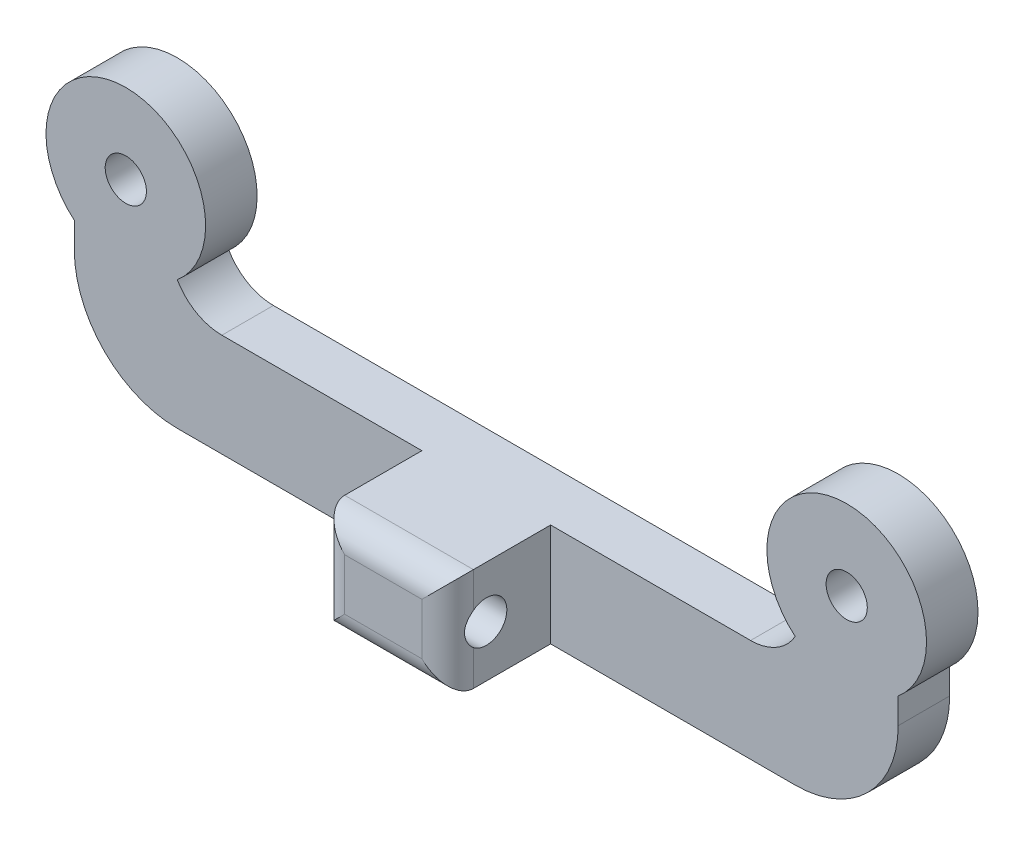
from build123d import *

# Parameters (mm, degrees)
CROQUIS1_R              = 1.6
SALIENTE_EXTRUIR1_DEPTH = 4
CROQUIS2_W              = 10
CROQUIS2_H              = 8
SALIENTE_EXTRUIR2_DEPTH = 8
CORTAR_EXTRUIR1_REACH   = 45.564
CROQUIS3_R              = 1.6
REDONDEO1_R             = 2
REDONDEO2_R             = 8
REDONDEO3_R             = 4


with BuildPart() as part:
    # Croquis1 → Saliente-Extruir1 (new body)
    with BuildSketch(Plane.XY):
        with BuildLine():
            Line((-4, -4.737087713), (-4, -14.737087713))
            Line((-4, -14.737087713), (60, -14.737087713))
            Line((60, -14.737087713), (60, -4.737087713))
            ThreePointArc((60, -4.737087713), (56, 6.2), (52, -4.737087713))
            Line((52, -4.737087713), (52, -6.737087713))
            Line((52, -6.737087713), (4, -6.737087713))
            Line((4, -6.737087713), (4, -4.737087713))
            ThreePointArc((4, -4.737087713), (0, 6.2), (-4, -4.737087713))
        make_face()
        Circle(CROQUIS1_R, mode=Mode.SUBTRACT)
        with Locations((56, 0)):
            Circle(CROQUIS1_R, mode=Mode.SUBTRACT)
    extrude(amount=SALIENTE_EXTRUIR1_DEPTH)

    # Croquis2 → Saliente-Extruir2 (add)
    with BuildSketch(Plane.XY.offset(4)):
        with Locations((28, -10.737087713)):
            Rectangle(CROQUIS2_W, CROQUIS2_H)
    extrude(amount=SALIENTE_EXTRUIR2_DEPTH)

    # Croquis3 → Cortar-Extruir1 (cut, up to next)
    with BuildSketch(Plane.ZY.offset(-23), mode=Mode.PRIVATE) as cortar_extruir1_sk1:
        with Locations((9, -10.737087713)):
            Circle(CROQUIS3_R)
    cortar_extruir1_tool1 = extrude(cortar_extruir1_sk1.sketch, amount=-CORTAR_EXTRUIR1_REACH, mode=Mode.PRIVATE) & part.part
    add(cortar_extruir1_tool1.solids().sort_by_distance((23, -10.737088, 9))[0], mode=Mode.SUBTRACT)

    # Redondeo1
    # the kernel refuses this fillet: 2 mm, written as the material it takes off along each edge
    with BuildSketch(Plane(origin=(33, -1.737087713, 12), x_dir=(-1, 0, 0), z_dir=(0, -1, 0))) as redondeo1_piece_1:
        with BuildLine():
            CenterArc((REDONDEO1_R, REDONDEO1_R), REDONDEO1_R, 180, 90)
            Line((0, REDONDEO1_R), (0, 0))
            Line((0, 0), (REDONDEO1_R, 0))
        make_face()
    extrude(amount=18, mode=Mode.SUBTRACT)
    with BuildSketch(Plane(origin=(23, -19.737087713, 12), x_dir=(0, 0, -1), z_dir=(0, 1, 0))) as redondeo1_piece_2:
        with BuildLine():
            CenterArc((REDONDEO1_R, -REDONDEO1_R), REDONDEO1_R, 90, 90)
            Line((0, -REDONDEO1_R), (0, 0))
            Line((0, 0), (REDONDEO1_R, 0))
        make_face()
    extrude(amount=18, mode=Mode.SUBTRACT)
    with BuildSketch(Plane(origin=(18, -6.737087713, 12), x_dir=(0, -1, 0), z_dir=(1, 0, 0))) as redondeo1_piece_3:
        with BuildLine():
            CenterArc((REDONDEO1_R, REDONDEO1_R), REDONDEO1_R, 180, 90)
            Line((0, REDONDEO1_R), (0, 0))
            Line((0, 0), (REDONDEO1_R, 0))
        make_face()
    extrude(amount=20, mode=Mode.SUBTRACT)
    with BuildSketch(Plane(origin=(38, -14.737087713, 12), x_dir=(0, 0, -1), z_dir=(-1, 0, 0))) as redondeo1_piece_4:
        with BuildLine():
            CenterArc((REDONDEO1_R, -REDONDEO1_R), REDONDEO1_R, 90, 90)
            Line((0, -REDONDEO1_R), (0, 0))
            Line((0, 0), (REDONDEO1_R, 0))
        make_face()
    extrude(amount=20, mode=Mode.SUBTRACT)

    # Redondeo2
    redondeo2_edges = [part.edges().sort_by_distance(p)[0] for p in [
        (60, -14.737087713, 2),
        (-4, -14.737087713, 2),
    ]]
    fillet(redondeo2_edges, radius=REDONDEO2_R)

    # Redondeo3
    # the kernel refuses this fillet: 4 mm, written as the material it adds along each edge
    with BuildSketch(Plane(origin=(52, -6.737087713, 0), x_dir=(-1, 0, 0), z_dir=(0, 0, 1))) as redondeo3_piece_1:
        with BuildLine():
            CenterArc((3.464101615, -4), REDONDEO3_R, 90, 60)
            Line((0, -2), (-0.069282032, -1.96))
            ThreePointArc((-0.069282032, -1.96), (-0.08, -1), (-0.08, 0))
            Line((-0.08, 0), (0, 0.08))
            Line((0, 0.08), (3.464101615, 0.08))
            Line((3.464101615, 0.08), (3.464101615, 0))
        make_face()
    extrude(amount=4)
    with BuildSketch(Plane(origin=(4, -6.737087713, 0), x_dir=(0, 1, 0), z_dir=(0, 0, 1))) as redondeo3_piece_2:
        with BuildLine():
            CenterArc((4, -3.464101615), REDONDEO3_R, 120, 60)
            Line((0, -3.464101615), (-0.08, -3.464101615))
            Line((-0.08, -3.464101615), (-0.08, 0))
            Line((-0.08, 0), (0, 0.08))
            ThreePointArc((0, 0.08), (1, 0.08), (1.96, 0.069282032))
            Line((1.96, 0.069282032), (2, 0))
        make_face()
    extrude(amount=4)


solid = part.part
